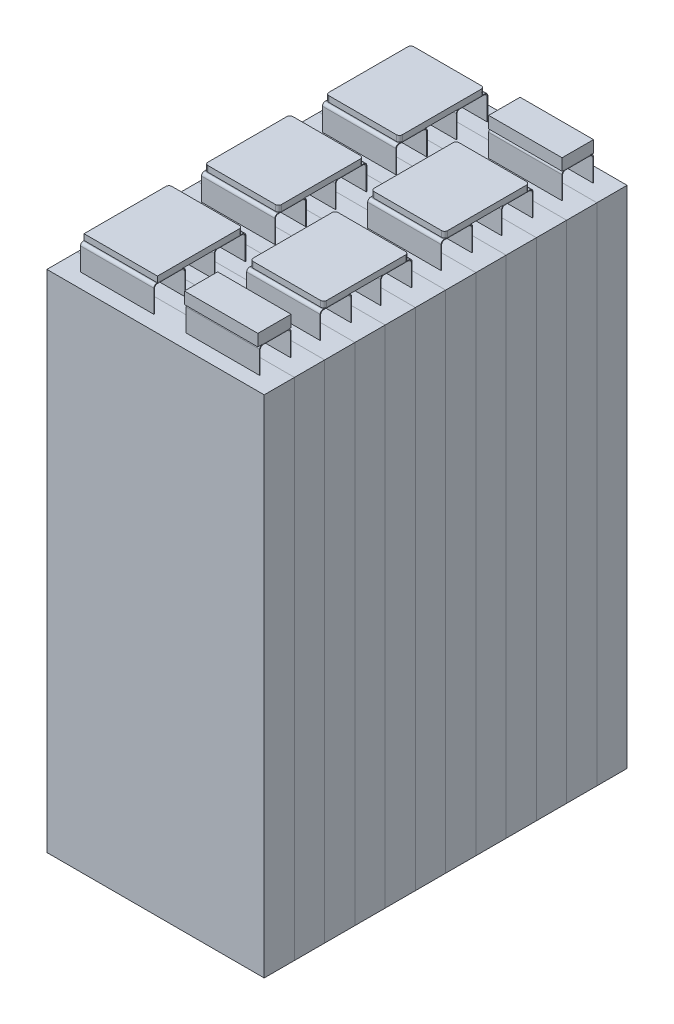
from build123d import *

# Parameters (mm, degrees)
CELL_BODY_S_W            = 74
CELL_BODY_S_H            = 172
CELL_BODY_DEPTH          = 10.3
TAB_S_W                  = 25
TAB_S_H                  = 0.2
TAB_DEPTH                = 8.5
TAB_BEND_S_W             = 25
TAB_BEND_S_H             = 9.5
TAB_BEND_DEPTH           = 0.2
TAB_FILLET_R             = 1
BUSBARS_DEPTH            = 2
BUSBARS_2_DEPTH          = 2
BUSBARS_3_DEPTH          = 2
BUSBARS_4_DEPTH          = 2
BUSBARS_5_DEPTH          = 2
BUSBARS_6_DEPTH          = 2
BUSBARS_7_DEPTH          = 2
BOSS_EXTRUDE1_DEPTH      = 2
BOSS_EXTRUDE2_DEPTH      = 1.2
BOSS_EXTRUDE2_DEPTH_BACK = 2
SKETCH4_W                = 25
SKETCH4_H                = 4
SKETCH5_W                = 25
SKETCH5_H                = 4
BOSS_EXTRUDE3_DEPTH      = 1
BOSS_EXTRUDE4_DEPTH      = 1.6
BOSS_EXTRUDE4_DEPTH_BACK = 2
SKETCH6_W                = 25
SKETCH6_H                = 4
BOSS_EXTRUDE5_DEPTH      = 1.2
BOSS_EXTRUDE5_DEPTH_BACK = 2
SKETCH7_W                = 25
SKETCH7_H                = 4


with BuildPart() as part:
    # Cell Body-S → Cell Body (new body)
    with BuildSketch(Plane.XY):
        with Locations((-20.312095277, -31.214665117)):
            Rectangle(CELL_BODY_S_W, CELL_BODY_S_H)
    extrude(amount=CELL_BODY_DEPTH)

    # Tab-S → Tab (add)
    with BuildSketch(Plane(origin=(0, 54.785334883, 0), x_dir=(1, 0, 0), z_dir=(0, 1, 0))):
        with Locations((-38.312095277, -5.05)):
            Rectangle(TAB_S_W, TAB_S_H)
        with Locations((-2.312095277, -5.05)):
            Rectangle(TAB_S_W, TAB_S_H)
    extrude(amount=TAB_DEPTH)

    # Tab Bend-S → Tab Bend (add)
    with BuildSketch(Plane(origin=(0, 63.285334883, 0), x_dir=(1, 0, 0), z_dir=(0, 1, 0))):
        with Locations((-38.312095277, -9.7)):
            Rectangle(TAB_BEND_S_W, TAB_BEND_S_H)
        with Locations((-2.312095277, -9.7)):
            Rectangle(TAB_BEND_S_W, TAB_BEND_S_H)
    extrude(amount=TAB_BEND_DEPTH)

    # Tab Fillet
    tab_fillet_edges = [part.edges().sort_by_distance(p)[0] for p in [
        (-38.312095277, 63.285334883, 5.15),
        (-2.312095277, 63.285334883, 5.15),
        (-38.312095277, 63.485334883, 4.95),
        (-2.312095277, 63.485334883, 4.95),
    ]]
    fillet(tab_fillet_edges, radius=TAB_FILLET_R)


with BuildPart() as body_2:
    # Cell 2: mirrored copy
    add(part.part.mirror(Plane.XY.offset(10.3)))


with BuildPart() as body_3:
    # Cell 3-4: mirrored copy
    add(body_2.part.mirror(Plane(origin=(0, 0, 20.6), x_dir=(1, 0, 0), z_dir=(0, 0, -1))))


with BuildPart() as body_4:
    # Cell 3-4 2: mirrored copy
    add(part.part.mirror(Plane(origin=(0, 0, 20.6), x_dir=(1, 0, 0), z_dir=(0, 0, -1))))


with BuildPart() as body_5:
    # Cell 5-8: mirrored copy
    add(body_4.part.mirror(Plane(origin=(0, 0, 41.2), x_dir=(1, 0, 0), z_dir=(0, 0, -1))))


with BuildPart() as body_6:
    # Cell 5-8 2: mirrored copy
    add(body_3.part.mirror(Plane(origin=(0, 0, 41.2), x_dir=(1, 0, 0), z_dir=(0, 0, -1))))


with BuildPart() as body_7:
    # Cell 5-8 3: mirrored copy
    add(body_2.part.mirror(Plane(origin=(0, 0, 41.2), x_dir=(1, 0, 0), z_dir=(0, 0, -1))))


with BuildPart() as body_8:
    # Cell 5-8 4: mirrored copy
    add(part.part.mirror(Plane(origin=(0, 0, 41.2), x_dir=(1, 0, 0), z_dir=(0, 0, -1))))


with BuildPart() as body_9:
    # Cell 9-10: mirrored copy
    add(body_8.part.mirror(Plane(origin=(0, 0, 82.4), x_dir=(1, 0, 0), z_dir=(0, 0, -1))))


with BuildPart() as body_10:
    # Cell 9-10 2: mirrored copy
    add(body_7.part.mirror(Plane(origin=(0, 0, 82.4), x_dir=(1, 0, 0), z_dir=(0, 0, -1))))


with BuildPart() as body_11:
    # Cell 11-12: mirrored copy
    add(body_10.part.mirror(Plane(origin=(0, 0, 103), x_dir=(1, 0, 0), z_dir=(0, 0, -1))))


with BuildPart() as body_12:
    # Cell 11-12 2: mirrored copy
    add(body_9.part.mirror(Plane(origin=(0, 0, 103), x_dir=(1, 0, 0), z_dir=(0, 0, -1))))


with BuildPart() as body_13:
    # Busbars-S → Busbars (new body)
    with BuildSketch(Plane(origin=(0, 63.485334883, 0), x_dir=(1, 0, 0), z_dir=(0, 1, 0))):
        with BuildLine():
            Line((-49.812095277, -6.15), (-26.812095277, -6.15))
            ThreePointArc((-26.812095277, -6.15), (-26.104988496, -6.442893219), (-25.812095277, -7.15))
            Line((-25.812095277, -7.15), (-25.812095277, -34.05))
            ThreePointArc((-25.812095277, -34.05), (-26.104988496, -34.757106781), (-26.812095277, -35.05))
            Line((-26.812095277, -35.05), (-49.812095277, -35.05))
            ThreePointArc((-49.812095277, -35.05), (-50.519202059, -34.757106781), (-50.812095277, -34.05))
            Line((-50.812095277, -34.05), (-50.812095277, -7.15))
            ThreePointArc((-50.812095277, -7.15), (-50.519202059, -6.442893219), (-49.812095277, -6.15))
        make_face()
    extrude(amount=BUSBARS_DEPTH)


with BuildPart() as body_14:
    # Busbars-S → Busbars 2 (new body)
    with BuildSketch(Plane(origin=(0, 63.485334883, 0), x_dir=(1, 0, 0), z_dir=(0, 1, 0))):
        with BuildLine():
            Line((-13.812095277, -26.75), (9.187904723, -26.75))
            ThreePointArc((9.187904723, -26.75), (9.895011504, -27.042893219), (10.187904723, -27.75))
            Line((10.187904723, -27.75), (10.187904723, -54.65))
            ThreePointArc((10.187904723, -54.65), (9.895011504, -55.357106781), (9.187904723, -55.65))
            Line((9.187904723, -55.65), (-13.812095277, -55.65))
            ThreePointArc((-13.812095277, -55.65), (-14.519202059, -55.357106781), (-14.812095277, -54.65))
            Line((-14.812095277, -54.65), (-14.812095277, -27.75))
            ThreePointArc((-14.812095277, -27.75), (-14.519202059, -27.042893219), (-13.812095277, -26.75))
        make_face()
    extrude(amount=BUSBARS_2_DEPTH)


with BuildPart() as body_15:
    # Busbars-S → Busbars 3 (new body)
    with BuildSketch(Plane(origin=(0, 63.485334883, 0), x_dir=(1, 0, 0), z_dir=(0, 1, 0))):
        with BuildLine():
            Line((-49.812095277, -47.35), (-26.812095277, -47.35))
            ThreePointArc((-26.812095277, -47.35), (-26.104988496, -47.642893219), (-25.812095277, -48.35))
            Line((-25.812095277, -48.35), (-25.812095277, -75.25))
            ThreePointArc((-25.812095277, -75.25), (-26.104988496, -75.957106781), (-26.812095277, -76.25))
            Line((-26.812095277, -76.25), (-49.812095277, -76.25))
            ThreePointArc((-49.812095277, -76.25), (-50.519202059, -75.957106781), (-50.812095277, -75.25))
            Line((-50.812095277, -75.25), (-50.812095277, -48.35))
            ThreePointArc((-50.812095277, -48.35), (-50.519202059, -47.642893219), (-49.812095277, -47.35))
        make_face()
    extrude(amount=BUSBARS_3_DEPTH)


with BuildPart() as body_16:
    # Busbars-S → Busbars 4 (new body)
    with BuildSketch(Plane(origin=(0, 63.485334883, 0), x_dir=(1, 0, 0), z_dir=(0, 1, 0))):
        with BuildLine():
            Line((-13.812095277, -67.95), (9.187904723, -67.95))
            ThreePointArc((9.187904723, -67.95), (9.895011504, -68.242893219), (10.187904723, -68.95))
            Line((10.187904723, -68.95), (10.187904723, -95.85))
            ThreePointArc((10.187904723, -95.85), (9.895011504, -96.557106781), (9.187904723, -96.85))
            Line((9.187904723, -96.85), (-13.812095277, -96.85))
            ThreePointArc((-13.812095277, -96.85), (-14.519202059, -96.557106781), (-14.812095277, -95.85))
            Line((-14.812095277, -95.85), (-14.812095277, -68.95))
            ThreePointArc((-14.812095277, -68.95), (-14.519202059, -68.242893219), (-13.812095277, -67.95))
        make_face()
    extrude(amount=BUSBARS_4_DEPTH)


with BuildPart() as body_17:
    # Busbars-S → Busbars 5 (new body)
    with BuildSketch(Plane(origin=(0, 63.485334883, 0), x_dir=(1, 0, 0), z_dir=(0, 1, 0))):
        with BuildLine():
            Line((-49.812095277, -88.55), (-26.812095277, -88.55))
            ThreePointArc((-26.812095277, -88.55), (-26.104988496, -88.842893219), (-25.812095277, -89.55))
            Line((-25.812095277, -89.55), (-25.812095277, -117.45))
            Line((-25.812095277, -117.45), (-50.812095277, -117.45))
            Line((-50.812095277, -117.45), (-50.812095277, -89.55))
            ThreePointArc((-50.812095277, -89.55), (-50.519202059, -88.842893219), (-49.812095277, -88.55))
        make_face()
    extrude(amount=BUSBARS_5_DEPTH)


with BuildPart() as body_18:
    # Busbars-S → Busbars 6 (new body)
    with BuildSketch(Plane(origin=(0, 63.485334883, 0), x_dir=(1, 0, 0), z_dir=(0, 1, 0))):
        with BuildLine():
            Line((-13.812095277, -14.45), (9.187904723, -14.45))
            ThreePointArc((9.187904723, -14.45), (9.895011504, -14.157106781), (10.187904723, -13.45))
            Line((10.187904723, -13.45), (10.187904723, -5.95))
            Line((10.187904723, -5.95), (-14.812095277, -5.95))
            Line((-14.812095277, -5.95), (-14.812095277, -13.45))
            ThreePointArc((-14.812095277, -13.45), (-14.519202059, -14.157106781), (-13.812095277, -14.45))
        make_face()
    extrude(amount=BUSBARS_6_DEPTH)



with BuildPart() as body_19:
    # Busbars-S → Busbars 7 (new body)
    with BuildSketch(Plane(origin=(0, 63.485334883, 0), x_dir=(1, 0, 0), z_dir=(0, 1, 0))):
        with BuildLine():
            Line((-13.812095277, -109.15), (10.187904723, -109.15))
            Line((10.187904723, -109.15), (10.187904723, -117.65))
            Line((10.187904723, -117.65), (-13.812095277, -117.65))
            ThreePointArc((-13.812095277, -117.65), (-14.519202059, -117.357106781), (-14.812095277, -116.65))
            Line((-14.812095277, -116.65), (-14.812095277, -110.15))
            ThreePointArc((-14.812095277, -110.15), (-14.519202059, -109.442893219), (-13.812095277, -109.15))
        make_face()
    extrude(amount=BUSBARS_7_DEPTH)


with BuildPart() as body_18_1:
    add(body_18.part)

    add(body_19.part)  # Boss-Extrude1 merges body 19
    # Sketch2 → Boss-Extrude1 (add)
    with BuildSketch(Plane(origin=(0, 65.485334883, 0), x_dir=(1, 0, 0), z_dir=(0, 1, 0))):
        with BuildLine():
            Line((-14.812095277, -5.95), (10.187904723, -5.95))
            Line((10.187904723, -5.95), (10.187904723, -13.45))
            ThreePointArc((10.187904723, -13.45), (9.895011504, -14.157106781), (9.187904723, -14.45))
            Line((9.187904723, -14.45), (-13.812095277, -14.45))
            ThreePointArc((-13.812095277, -14.45), (-14.519202059, -14.157106781), (-14.812095277, -13.45))
            Line((-14.812095277, -13.45), (-14.812095277, -5.95))
        make_face()
        with BuildLine():
            Line((10.187904723, -109.15), (-13.812095277, -109.15))
            ThreePointArc((-13.812095277, -109.15), (-14.519202059, -109.442893219), (-14.812095277, -110.15))
            Line((-14.812095277, -110.15), (-14.812095277, -116.65))
            ThreePointArc((-14.812095277, -116.65), (-14.519202059, -117.357106781), (-13.812095277, -117.65))
            Line((-13.812095277, -117.65), (10.187904723, -117.65))
            Line((10.187904723, -117.65), (10.187904723, -109.15))
        make_face()
    extrude(amount=BOSS_EXTRUDE1_DEPTH)

    # Sketch4 → Boss-Extrude2 (add, two sides: drawn at the far end of the back side and taken through both)
    with BuildSketch(Plane.XY.offset(14.45).offset(-BOSS_EXTRUDE2_DEPTH_BACK)):
        with Locations((-2.312095277, 65.485334883)):
            Rectangle(SKETCH4_W, SKETCH4_H)
    extrude(amount=BOSS_EXTRUDE2_DEPTH + BOSS_EXTRUDE2_DEPTH_BACK)

    # Sketch5 → Boss-Extrude3 (add)
    with BuildSketch(Plane(origin=(0, 0, 5.95), x_dir=(-1, 0, 0), z_dir=(0, 0, -1))):
        with Locations((2.312095277, 65.485334883)):
            Rectangle(SKETCH5_W, SKETCH5_H)
    extrude(amount=BOSS_EXTRUDE3_DEPTH)

    # Sketch6 → Boss-Extrude4 (add, two sides: drawn at the far end of the back side and taken through both)
    with BuildSketch(Plane.XY.offset(117.65).offset(-BOSS_EXTRUDE4_DEPTH_BACK)):
        with Locations((-2.312095277, 65.485334883)):
            Rectangle(SKETCH6_W, SKETCH6_H)
    extrude(amount=BOSS_EXTRUDE4_DEPTH + BOSS_EXTRUDE4_DEPTH_BACK)

    # Sketch7 → Boss-Extrude5 (add, two sides: drawn at the far end of the back side and taken through both)
    with BuildSketch(Plane(origin=(0, 0, 109.15), x_dir=(-1, 0, 0), z_dir=(0, 0, -1)).offset(-BOSS_EXTRUDE5_DEPTH_BACK)):
        with Locations((2.312095277, 65.485334883)):
            Rectangle(SKETCH7_W, SKETCH7_H)
    extrude(amount=BOSS_EXTRUDE5_DEPTH + BOSS_EXTRUDE5_DEPTH_BACK)


solid = Compound([part.part, body_2.part, body_3.part, body_4.part, body_5.part, body_6.part, body_7.part, body_8.part, body_9.part, body_10.part, body_11.part, body_12.part, body_13.part, body_14.part, body_15.part, body_16.part, body_17.part, body_18_1.part])
